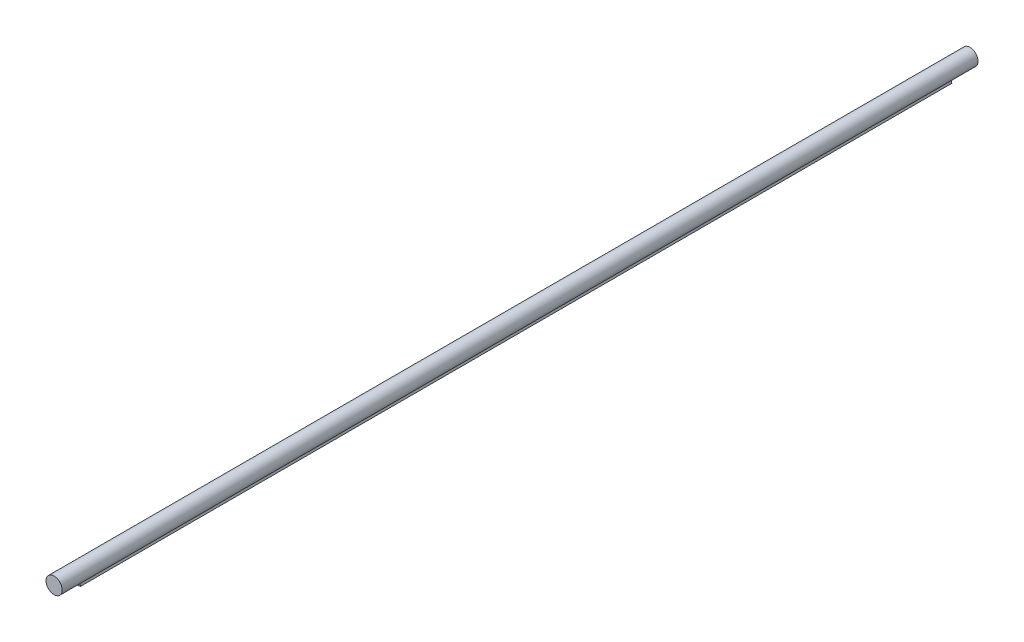
from build123d import *
from OCP.BRepAlgoAPI import BRepAlgoAPI_Cut
from OCP.TopTools import TopTools_ListOfShape

# Parameters (mm, degrees)
BOSS_EXTRUDE1_START = -68.064063
BOSS_EXTRUDE1_DEPTH = 898.128125
CUT_EXTRUDE1_START  = -21.828125
SKETCH2_R           = 10.589945851
SKETCH2_R_2         = 7.9375
CUT_EXTRUDE1_DEPTH  = 21.828125
CUT_EXTRUDE2_START  = -898.128125
SKETCH2_2_R         = 10.589945851
SKETCH2_2_R_2       = 7.9375
CUT_EXTRUDE2_DEPTH  = 21.828125


with BuildPart() as part:
    # Sketch1 → Boss-Extrude1 (new body)
    with BuildSketch(Plane.XY.offset(BOSS_EXTRUDE1_START)):
        with BuildLine():
            Line((4.035093565, -9.791065981), (3.586322342, -7.081115612))
            ThreePointArc((3.586322342, -7.081115612), (-1.296798787, 7.830850475), (-1.112187943, -7.859194884))
            Line((-1.112187943, -7.859194884), (-0.663416719, -10.569145253))
            Line((-0.663416719, -10.569145253), (4.035093565, -9.791065981))
        make_face()
    extrude(amount=BOSS_EXTRUDE1_DEPTH)

    # Sketch2 → Cut-Extrude1 (cut)
    with BuildSketch(Plane.XY.offset(830.0640625).offset(CUT_EXTRUDE1_START)):
        Circle(SKETCH2_R)
        with Locations(Location((0, 0, 0), (0, 0, 261.945315936))):
            Circle(SKETCH2_R_2, mode=Mode.SUBTRACT)
    extrude(amount=CUT_EXTRUDE1_DEPTH, mode=Mode.SUBTRACT)


with BuildPart() as cut_extrude2_tool:
    # Sketch2<2> → Cut-Extrude2 (new body)
    with BuildSketch(Plane.XY.offset(830.0640625).offset(CUT_EXTRUDE2_START)):
        Circle(SKETCH2_2_R)
        with Locations(Location((0, 0, 0), (0, 0, 180))):
            Circle(SKETCH2_2_R_2, mode=Mode.SUBTRACT)
    extrude(amount=CUT_EXTRUDE2_DEPTH)


with BuildPart() as part_1:
    add(part.part)

    # Cut-Extrude2: cut by cut_extrude2_tool, with a tolerance
    cut_extrude2_stock = TopTools_ListOfShape()
    cut_extrude2_stock.Append(part_1.part.wrapped)
    cut_extrude2_tools = TopTools_ListOfShape()
    cut_extrude2_tools.Append(cut_extrude2_tool.part.wrapped)
    cut_extrude2_cut = BRepAlgoAPI_Cut()
    cut_extrude2_cut.SetArguments(cut_extrude2_stock)
    cut_extrude2_cut.SetTools(cut_extrude2_tools)
    cut_extrude2_cut.SetFuzzyValue(0.00001)
    cut_extrude2_cut.Build()
    add(Compound.cast(cut_extrude2_cut.Shape()).solids(), mode=Mode.REPLACE)


solid = part_1.part
